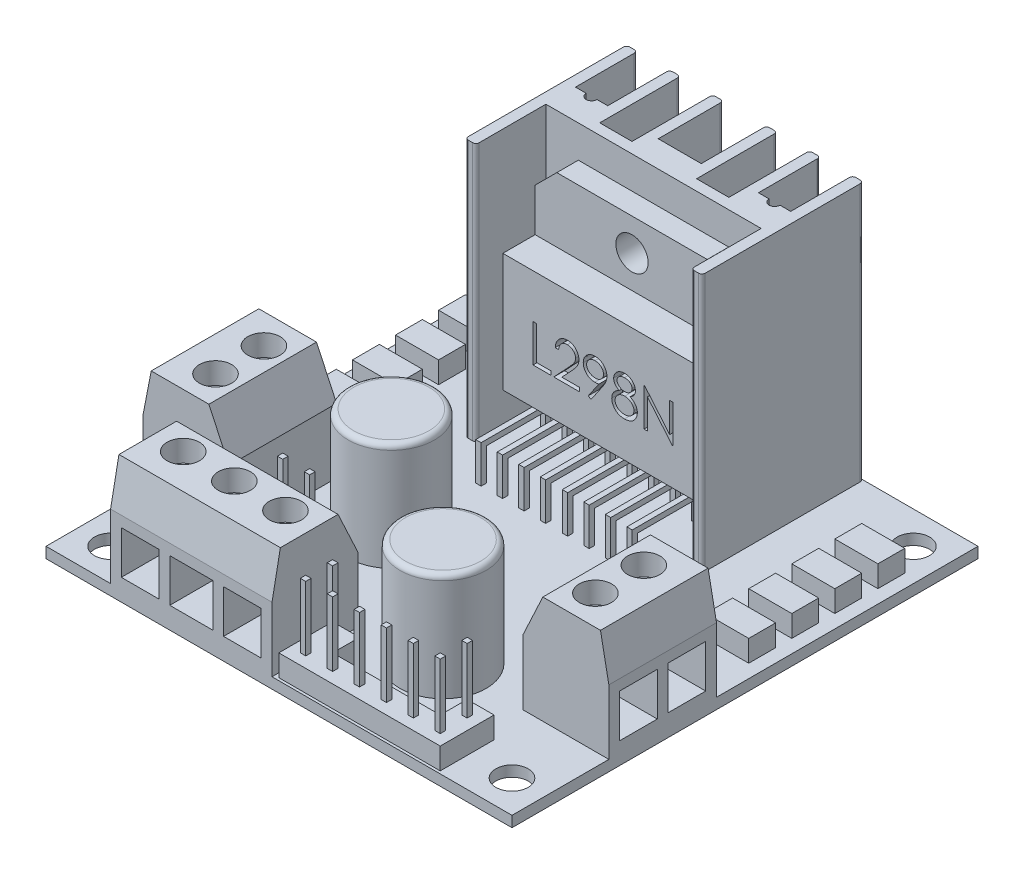
from build123d import *

# Parameters (mm, degrees)
CROQUIS1_W               = 43.3
CROQUIS1_H               = 43.3
CROQUIS1_R               = 1.5
SALIENTE_EXTRUIR1_DEPTH  = 1
SALIENTE_EXTRUIR2_DEPTH  = 24
CROQUIS3_W               = 8
CROQUIS3_H               = 10
SALIENTE_EXTRUIR3_DEPTH  = 10
CHAFL_N1_SIZE            = 4
CHAFL_N1_SIZE2           = 1.865230633
CHAFL_N2_SIZE            = 4
CHAFL_N2_SIZE2           = 1.865230633
CHAFL_N3_SIZE            = 4
CHAFL_N3_SIZE2           = 0.777521237
CHAFL_N4_SIZE            = 4
CHAFL_N4_SIZE2           = 0.777521237
CROQUIS4_W               = 15
CROQUIS4_H               = 8
SALIENTE_EXTRUIR4_DEPTH  = 10
CHAFL_N5_SIZE            = 4
CHAFL_N5_SIZE2           = 0.777521237
CHAFL_N6_SIZE            = 4
CHAFL_N6_SIZE2           = 1.865230633
CROQUIS5_W               = 4
CROQUIS5_H               = 2.5
SALIENTE_EXTRUIR5_DEPTH  = 2
CROQUIS6_R               = 4
SALIENTE_EXTRUIR6_DEPTH  = 10
REDONDEO1_R              = 0.5
SALIENTE_EXTRUIR7_DEPTH  = 2
CROQUIS8_W               = 5
CROQUIS8_H               = 2.5
SALIENTE_EXTRUIR8_DEPTH  = 2
CROQUIS9_W               = 0.5
CROQUIS9_H               = 0.5
SALIENTE_EXTRUIR9_DEPTH  = 6
CROQUIS10_W              = 0.5
CROQUIS10_H              = 0.5
SALIENTE_EXTRUIR10_DEPTH = 6
SALIENTE_EXTRUIR11_DEPTH = 5
CORTAR_EXTRUIR1_DEPTH    = 3
CROQUIS13_W              = 0.5
CROQUIS13_H              = 0.5
SALIENTE_EXTRUIR12_DEPTH = 1
CROQUIS14_W              = 0.5
CROQUIS14_H              = 0.5
SALIENTE_EXTRUIR13_DEPTH = 7
CROQUIS15_W              = 0.5
CROQUIS15_H              = 0.5
SALIENTE_EXTRUIR14_DEPTH = 4
CROQUIS16_W              = 0.5
CROQUIS16_H              = 0.5
SALIENTE_EXTRUIR15_DEPTH = 4
CORTAR_EXTRUIR2_DEPTH    = 1
CROQUIS18_R              = 1.5
CORTAR_EXTRUIR3_DEPTH    = 60.797407971
CROQUIS19_W              = 3.5
CROQUIS19_H              = 4
CORTAR_EXTRUIR4_DEPTH    = 4
CROQUIS20_W              = 3.5
CROQUIS20_H              = 4
CROQUIS20_W_2            = 4
CORTAR_EXTRUIR5_DEPTH    = 4
CROQUIS21_W              = 3.5
CROQUIS21_H              = 4
CORTAR_EXTRUIR6_DEPTH    = 4
CROQUIS22_R              = 1.5
CORTAR_EXTRUIR7_DEPTH    = 2
REDONDEO2_R              = 0.3


with BuildPart() as part:
    # Croquis1 → Saliente-Extruir1 (new body)
    with BuildSketch(Plane(origin=(0, 0, 0), x_dir=(1, 0, 0), z_dir=(0, 1, 0))):
        with Locations((-21.65, -21.65)):
            Rectangle(CROQUIS1_W, CROQUIS1_H)
        with Locations((-40.3, -40.3)):
            Circle(CROQUIS1_R, mode=Mode.SUBTRACT)
        with Locations((-3, -40.3)):
            Circle(CROQUIS1_R, mode=Mode.SUBTRACT)
        with Locations((-3, -3)):
            Circle(CROQUIS1_R, mode=Mode.SUBTRACT)
        with Locations((-40.3, -3)):
            Circle(CROQUIS1_R, mode=Mode.SUBTRACT)
    extrude(amount=SALIENTE_EXTRUIR1_DEPTH)

    # Croquis2 → Saliente-Extruir2 (add)
    with BuildSketch(Plane(origin=(0, 1, 0), x_dir=(-1, 0, 0), z_dir=(0, 1, 0))):
        with BuildLine():
            Line((10.65, 0), (11.65, 0))
            Line((11.65, 0), (11.65, 5.75316787))
            Line((11.65, 5.75316787), (12.645779613, 5.75316787))
            ThreePointArc((12.645779613, 5.75316787), (13.15, 6.257388257), (13.654220387, 5.75316787))
            Line((13.654220387, 5.75316787), (14.65, 5.75316787))
            Line((14.65, 5.75316787), (14.65, 0))
            Line((14.65, 0), (15.65, 0))
            Line((15.65, 0), (15.65, 7.5))
            Line((15.65, 7.5), (18.65, 7.5))
            Line((18.65, 7.5), (18.65, 0))
            Line((18.65, 0), (19.65, 0))
            Line((19.65, 0), (19.65, 6.064692241))
            Line((19.65, 6.064692241), (23.65, 6.064692241))
            Line((23.65, 6.064692241), (23.65, 0))
            Line((23.65, 0), (24.65, 0))
            Line((24.65, 0), (24.65, 7.5))
            Line((24.65, 7.5), (27.65, 7.5))
            Line((27.65, 7.5), (27.65, 0))
            Line((27.65, 0), (28.65, 0))
            Line((28.65, 0), (28.65, 5.75316787))
            Line((28.65, 5.75316787), (29.645779613, 5.75316787))
            ThreePointArc((29.645779613, 5.75316787), (30.15, 6.257388257), (30.654220387, 5.75316787))
            Line((30.654220387, 5.75316787), (31.65, 5.75316787))
            Line((31.65, 5.75316787), (31.65, 0))
            Line((31.65, 0), (32.65, 0))
            Line((32.65, 0), (32.65, 15))
            Line((32.65, 15), (31.65, 15))
            Line((31.65, 15), (31.65, 8.5))
            Line((31.65, 8.5), (11.65, 8.5))
            Line((11.65, 8.5), (11.65, 15))
            Line((11.65, 15), (10.65, 15))
            Line((10.65, 15), (10.65, 0))
        make_face()
    extrude(amount=SALIENTE_EXTRUIR2_DEPTH)

    # Croquis3 → Saliente-Extruir3 (add)
    with BuildSketch(Plane(origin=(0, 1, 0), x_dir=(-1, 0, 0), z_dir=(0, 1, 0))):
        with Locations((39.3, 29.3)):
            Rectangle(CROQUIS3_W, CROQUIS3_H)
        with Locations((4, 29.3)):
            Rectangle(CROQUIS3_W, CROQUIS3_H)
    extrude(amount=SALIENTE_EXTRUIR3_DEPTH)

    # Chaflán1
    chafl_n1_edges = [part.edges().sort_by_distance(p)[0] for p in [
        (-35.3, 11, 29.3),
    ]]
    chafl_n1_side = [part.faces().sort_by_distance(p)[0] for p in [
        (-35.3, 6, 29.3),
    ]]
    chamfer(chafl_n1_edges, length=CHAFL_N1_SIZE, length2=CHAFL_N1_SIZE2, reference=chafl_n1_side[0])

    # Chaflán2
    chafl_n2_edges = [part.edges().sort_by_distance(p)[0] for p in [
        (-8, 11, 29.3),
    ]]
    chafl_n2_side = [part.faces().sort_by_distance(p)[0] for p in [
        (-8, 6, 29.3),
    ]]
    chamfer(chafl_n2_edges, length=CHAFL_N2_SIZE, length2=CHAFL_N2_SIZE2, reference=chafl_n2_side[0])

    # Chaflán3
    chafl_n3_edges = [part.edges().sort_by_distance(p)[0] for p in [
        (0, 11, 29.3),
    ]]
    chafl_n3_side = [part.faces().sort_by_distance(p)[0] for p in [
        (0, 4.338101884, 26.988450803),
    ]]
    chamfer(chafl_n3_edges, length=CHAFL_N3_SIZE, length2=CHAFL_N3_SIZE2, reference=chafl_n3_side[0])

    # Chaflán4
    chafl_n4_edges = [part.edges().sort_by_distance(p)[0] for p in [
        (-43.3, 11, 29.3),
    ]]
    chafl_n4_side = [part.faces().sort_by_distance(p)[0] for p in [
        (-43.3, 4.338101884, 26.988450803),
    ]]
    chamfer(chafl_n4_edges, length=CHAFL_N4_SIZE, length2=CHAFL_N4_SIZE2, reference=chafl_n4_side[0])

    # Croquis4 → Saliente-Extruir4 (add)
    with BuildSketch(Plane(origin=(0, 1, 0), x_dir=(-1, 0, 0), z_dir=(0, 1, 0))):
        with Locations((29.8, 39.3)):
            Rectangle(CROQUIS4_W, CROQUIS4_H)
    extrude(amount=SALIENTE_EXTRUIR4_DEPTH)

    # Chaflán5
    chafl_n5_edges = [part.edges().sort_by_distance(p)[0] for p in [
        (-29.8, 11, 43.3),
    ]]
    chafl_n5_side = [part.faces().sort_by_distance(p)[0] for p in [
        (-27.97436627, 4.767977237, 43.3),
    ]]
    chamfer(chafl_n5_edges, length=CHAFL_N5_SIZE, length2=CHAFL_N5_SIZE2, reference=chafl_n5_side[0])

    # Chaflán6
    chafl_n6_edges = [part.edges().sort_by_distance(p)[0] for p in [
        (-29.8, 11, 35.3),
    ]]
    chafl_n6_side = [part.faces().sort_by_distance(p)[0] for p in [
        (-29.8, 6, 35.3),
    ]]
    chamfer(chafl_n6_edges, length=CHAFL_N6_SIZE, length2=CHAFL_N6_SIZE2, reference=chafl_n6_side[0])

    # Croquis5 → Saliente-Extruir5 (add)
    with BuildSketch(Plane(origin=(0, 1, 0), x_dir=(-1, 0, 0), z_dir=(0, 1, 0))):
        with Locations((3.239216948, 10.814133786)):
            Rectangle(CROQUIS5_W, CROQUIS5_H)
        with Locations((3.239216948, 6.814133786)):
            Rectangle(CROQUIS5_W, CROQUIS5_H)
        with Locations((3.239216948, 14.814133786)):
            Rectangle(CROQUIS5_W, CROQUIS5_H)
        with Locations((3.239216948, 18.814133786)):
            Rectangle(CROQUIS5_W, CROQUIS5_H)
        with Locations((40.060783052, 18.814133786)):
            Rectangle(CROQUIS5_W, CROQUIS5_H)
        with Locations((40.060783052, 14.814133786)):
            Rectangle(CROQUIS5_W, CROQUIS5_H)
        with Locations((40.060783052, 10.814133786)):
            Rectangle(CROQUIS5_W, CROQUIS5_H)
        with Locations((40.060783052, 6.814133786)):
            Rectangle(CROQUIS5_W, CROQUIS5_H)
    extrude(amount=SALIENTE_EXTRUIR5_DEPTH)

    # Croquis6 → Saliente-Extruir6 (add)
    with BuildSketch(Plane(origin=(0, 1, 0), x_dir=(-1, 0, 0), z_dir=(0, 1, 0))):
        with Locations((28.3, 26.210008209)):
            Circle(CROQUIS6_R)
        with Locations((15.406645961, 34.3)):
            Circle(CROQUIS6_R)
    extrude(amount=SALIENTE_EXTRUIR6_DEPTH)

    # Redondeo1
    redondeo1_edges = [part.edges().sort_by_distance(p)[0] for p in [
        (-24.3, 11, 26.210008209),
        (-11.406645961, 11, 34.3),
    ]]
    fillet(redondeo1_edges, radius=REDONDEO1_R)

    # Croquis7 → Saliente-Extruir7 (add)
    with BuildSketch(Plane(origin=(0, 1, 0), x_dir=(-1, 0, 0), z_dir=(0, 1, 0))):
        Polygon((19.407725127, 40.559550143), (19.407725127, 38.059550143), (21.907725127, 38.059550143), (21.907725127, 40.559550143), (21.907725127, 43.059550143), (6.907725127, 43.059550143), (6.907725127, 38.059550143), (9.407725127, 38.059550143), (9.407725127, 40.559550143), align=None)
    extrude(amount=SALIENTE_EXTRUIR7_DEPTH)

    # Croquis8 → Saliente-Extruir8 (add)
    with BuildSketch(Plane(origin=(0, 1, 0), x_dir=(-1, 0, 0), z_dir=(0, 1, 0))):
        with Locations((30.3, 33.05)):
            Rectangle(CROQUIS8_W, CROQUIS8_H)
    extrude(amount=SALIENTE_EXTRUIR8_DEPTH)

    # Croquis9 → Saliente-Extruir9 (add)
    with BuildSketch(Plane(origin=(0, 3, 0), x_dir=(-1, 0, 0), z_dir=(0, 1, 0))):
        with Locations((20.657725127, 39.309550143)):
            Rectangle(CROQUIS9_W, CROQUIS9_H)
        with Locations((8.157725127, 39.309550143)):
            Rectangle(CROQUIS9_W, CROQUIS9_H)
        with Locations((20.657725127, 41.809550143)):
            Rectangle(CROQUIS9_W, CROQUIS9_H)
        with Locations((8.157725127, 41.809550143)):
            Rectangle(CROQUIS9_W, CROQUIS9_H)
        with Locations((18.157725127, 41.809550143)):
            Rectangle(CROQUIS9_W, CROQUIS9_H)
        with Locations((10.657725127, 41.809550143)):
            Rectangle(CROQUIS9_W, CROQUIS9_H)
        with Locations((15.657725127, 41.809550143)):
            Rectangle(CROQUIS9_W, CROQUIS9_H)
        with Locations((13.157725127, 41.809550143)):
            Rectangle(CROQUIS9_W, CROQUIS9_H)
    extrude(amount=SALIENTE_EXTRUIR9_DEPTH)

    # Croquis10 → Saliente-Extruir10 (add)
    with BuildSketch(Plane(origin=(0, 3, 0), x_dir=(1, 0, 0), z_dir=(0, 1, 0))):
        with Locations((-29.05, -33.05)):
            Rectangle(CROQUIS10_W, CROQUIS10_H)
        with Locations((-31.55, -33.05)):
            Rectangle(CROQUIS10_W, CROQUIS10_H)
    extrude(amount=SALIENTE_EXTRUIR10_DEPTH)

    # Croquis11 → Saliente-Extruir11 (add)
    with BuildSketch(Plane.XY.offset(8.5)):
        Polygon((-14.662533558, 22), (-28.637466442, 22), (-30.65, 19.987466442), (-30.65, 5), (-12.65, 5), (-12.65, 19.987466442), align=None)
    extrude(amount=SALIENTE_EXTRUIR11_DEPTH)

    # Croquis12 → Cortar-Extruir1 (cut)
    with BuildSketch(Plane.XY.offset(13.5)):
        Polygon((-14.662533558, 22), (-28.637466442, 22), (-30.65, 19.987466442), (-30.65, 16), (-12.65, 16), (-12.65, 19.987466442), align=None)
    extrude(amount=-CORTAR_EXTRUIR1_DEPTH, mode=Mode.SUBTRACT)

    # Croquis13 → Saliente-Extruir12 (add)
    with BuildSketch(Plane.XZ.offset(-5)):
        with Locations((-28.173070454, 11)):
            Rectangle(CROQUIS13_W, CROQUIS13_H)
        with Locations((-29.173070454, 11)):
            Rectangle(CROQUIS13_W, CROQUIS13_H)
        with Locations((-27.173070454, 11)):
            Rectangle(CROQUIS13_W, CROQUIS13_H)
        with Locations((-26.173070454, 11)):
            Rectangle(CROQUIS13_W, CROQUIS13_H)
        with Locations((-25.173070454, 11)):
            Rectangle(CROQUIS13_W, CROQUIS13_H)
        with Locations((-24.173070454, 11)):
            Rectangle(CROQUIS13_W, CROQUIS13_H)
        with Locations((-23.173070454, 11)):
            Rectangle(CROQUIS13_W, CROQUIS13_H)
        with Locations((-22.173070454, 11)):
            Rectangle(CROQUIS13_W, CROQUIS13_H)
        with Locations((-21.126929546, 11)):
            Rectangle(CROQUIS13_W, CROQUIS13_H)
        with Locations((-20.126929546, 11)):
            Rectangle(CROQUIS13_W, CROQUIS13_H)
        with Locations((-19.126929546, 11)):
            Rectangle(CROQUIS13_W, CROQUIS13_H)
        with Locations((-18.126929546, 11)):
            Rectangle(CROQUIS13_W, CROQUIS13_H)
        with Locations((-17.126929546, 11)):
            Rectangle(CROQUIS13_W, CROQUIS13_H)
        with Locations((-16.126929546, 11)):
            Rectangle(CROQUIS13_W, CROQUIS13_H)
        with Locations((-15.126929546, 11)):
            Rectangle(CROQUIS13_W, CROQUIS13_H)
        with Locations((-14.126929546, 11)):
            Rectangle(CROQUIS13_W, CROQUIS13_H)
    extrude(amount=SALIENTE_EXTRUIR12_DEPTH)

    # Croquis14 → Saliente-Extruir13 (add)
    with BuildSketch(Plane.XY.offset(11.25)):
        with Locations((-14.126929546, 4.25)):
            Rectangle(CROQUIS14_W, CROQUIS14_H)
        with Locations((-16.126929546, 4.25)):
            Rectangle(CROQUIS14_W, CROQUIS14_H)
        with Locations((-18.126929546, 4.25)):
            Rectangle(CROQUIS14_W, CROQUIS14_H)
        with Locations((-20.126929546, 4.25)):
            Rectangle(CROQUIS14_W, CROQUIS14_H)
        with Locations((-22.173070454, 4.25)):
            Rectangle(CROQUIS14_W, CROQUIS14_H)
        with Locations((-24.173070454, 4.25)):
            Rectangle(CROQUIS14_W, CROQUIS14_H)
        with Locations((-26.173070454, 4.25)):
            Rectangle(CROQUIS14_W, CROQUIS14_H)
        with Locations((-28.173070454, 4.25)):
            Rectangle(CROQUIS14_W, CROQUIS14_H)
    extrude(amount=SALIENTE_EXTRUIR13_DEPTH)

    # Croquis15 → Saliente-Extruir14 (add)
    with BuildSketch(Plane.XZ):
        with Locations((-28.173070454, 18)):
            Rectangle(CROQUIS15_W, CROQUIS15_H)
        with Locations((-26.173070454, 18)):
            Rectangle(CROQUIS15_W, CROQUIS15_H)
        with Locations((-24.173070454, 18)):
            Rectangle(CROQUIS15_W, CROQUIS15_H)
        with Locations((-22.173070454, 18)):
            Rectangle(CROQUIS15_W, CROQUIS15_H)
        with Locations((-20.126929546, 18)):
            Rectangle(CROQUIS15_W, CROQUIS15_H)
        with Locations((-18.126929546, 18)):
            Rectangle(CROQUIS15_W, CROQUIS15_H)
        with Locations((-16.126929546, 18)):
            Rectangle(CROQUIS15_W, CROQUIS15_H)
        with Locations((-14.126929546, 18)):
            Rectangle(CROQUIS15_W, CROQUIS15_H)
    extrude(amount=-SALIENTE_EXTRUIR14_DEPTH)

    # Croquis16 → Saliente-Extruir15 (add)
    with BuildSketch(Plane.XZ):
        with Locations((-29.173070454, 11)):
            Rectangle(CROQUIS16_W, CROQUIS16_H)
        with Locations((-27.173070454, 11)):
            Rectangle(CROQUIS16_W, CROQUIS16_H)
        with Locations((-25.173070454, 11)):
            Rectangle(CROQUIS16_W, CROQUIS16_H)
        with Locations((-23.173070454, 11)):
            Rectangle(CROQUIS16_W, CROQUIS16_H)
        with Locations((-21.126929546, 11)):
            Rectangle(CROQUIS16_W, CROQUIS16_H)
        with Locations((-19.126929546, 11)):
            Rectangle(CROQUIS16_W, CROQUIS16_H)
        with Locations((-17.126929546, 11)):
            Rectangle(CROQUIS16_W, CROQUIS16_H)
        with Locations((-15.126929546, 11)):
            Rectangle(CROQUIS16_W, CROQUIS16_H)
    extrude(amount=-SALIENTE_EXTRUIR15_DEPTH)

    # Croquis17 → Cortar-Extruir2 (cut)
    # profile 1 of 5: a face of its own
    with BuildSketch(Plane.XY.offset(13.5)):
        Polygon((-27.846931762, 11.915865738), (-27.532829198, 11.915865738), (-27.532829198, 8.774840097), (-26.186675351, 8.774840097), (-26.186675351, 8.415865738), (-27.846931762, 8.415865738), align=None)
    # profile 2 of 5: a face of its own
    with BuildSketch(Plane.XY.offset(13.5)):
        with BuildLine():
            Line((-25.468726633, 10.838942661), (-25.782829198, 10.838942661))
            add(Edge.make_bspline(
                [(-25.782829198, 10.838942661), (-25.780782045, 10.880613549), (-25.77676149, 10.962454063), (-25.757933201, 11.08177797), (-25.730992324, 11.195832768), (-25.69290087, 11.303702682), (-25.645594592, 11.40634149), (-25.588864565, 11.503341505), (-25.521670714, 11.594332694), (-25.44546398, 11.678471537), (-25.362695341, 11.755659108), (-25.273389402, 11.822314351), (-25.179544374, 11.878632022), (-25.081444976, 11.925713264), (-24.977984412, 11.96105311), (-24.870101554, 11.98727475), (-24.757322418, 12.003051095), (-24.680482396, 12.004746881), (-24.641402915, 12.005609328)],
                knots=[0, 0, 0, 0, 1.10065271, 2.161652631, 3.183658789, 4.190468796, 5.17591951, 6.163126047, 7.15150782, 8.156236427, 9.156009102, 10.134482811, 11.092018607, 12.041330605, 13.001268258, 13.972401359, 14.968799086, 16, 16, 16, 16], degree=3))
            add(Edge.make_bspline(
                [(-24.641402915, 12.005609328), (-24.603024841, 12.004710871), (-24.527613297, 12.002945436), (-24.417551282, 11.987784407), (-24.312773988, 11.964038815), (-24.213486221, 11.930723399), (-24.120480157, 11.885938972), (-24.033057112, 11.832141433), (-23.950176301, 11.769921602), (-23.875569518, 11.696667788), (-23.807061439, 11.618465404), (-23.747959183, 11.5349775), (-23.69734602, 11.448748214), (-23.65515834, 11.359120013), (-23.624102201, 11.265248985), (-23.600523993, 11.168501782), (-23.587196579, 11.067876971), (-23.585151156, 10.999770415), (-23.584111249, 10.965144584)],
                knots=[0, 0, 0, 0, 1.111607364, 2.184268762, 3.212621178, 4.221274766, 5.211760367, 6.196651075, 7.1921475, 8.207485113, 9.220403448, 10.201281604, 11.166441695, 12.114753415, 13.065576456, 14.026450734, 14.996634279, 16, 16, 16, 16], degree=3))
            add(Edge.make_bspline(
                [(-23.584111249, 10.965144584), (-23.585804512, 10.916396749), (-23.589161323, 10.819756536), (-23.6178757, 10.677741673), (-23.662722211, 10.540148254), (-23.716719568, 10.429410952), (-23.771192012, 10.340177458), (-23.820279519, 10.266708753), (-23.87774433, 10.187603285), (-23.944422828, 10.103125947), (-24.0189357, 10.012615042), (-24.101957864, 9.916125247), (-24.194081346, 9.814653477), (-24.258739846, 9.745347876), (-24.292244262, 9.709435449)],
                knots=[0, 0, 0, 0, 1.184426356, 2.348067706, 3.509069118, 4.696110526, 5.333549288, 6.050745305, 6.844228056, 7.710549037, 8.667450064, 9.695053472, 10.805634456, 12, 12, 12, 12], degree=3))
            Line((-24.292244262, 9.709435449), (-25.167945383, 8.774840097))
            Line((-25.167945383, 8.774840097), (-23.539239454, 8.774840097))
            Line((-23.539239454, 8.774840097), (-23.539239454, 8.415865738))
            Line((-23.539239454, 8.415865738), (-25.917444582, 8.415865738))
            Line((-25.917444582, 8.415865738), (-24.560072787, 9.864383366))
            add(Edge.make_bspline(
                [(-24.560072787, 9.864383366), (-24.5270249, 9.898881673), (-24.463546673, 9.965145859), (-24.373764097, 10.061888819), (-24.293125108, 10.15163836), (-24.221107715, 10.234224909), (-24.15927421, 10.310856476), (-24.104401978, 10.37905118), (-24.060436387, 10.44180563), (-24.012720991, 10.514546244), (-23.96650701, 10.603358561), (-23.926794654, 10.711892251), (-23.902579806, 10.823619503), (-23.89967497, 10.89912154), (-23.898213813, 10.937099712)],
                knots=[0, 0, 0, 0, 1.329631726, 2.553950428, 3.673215718, 4.687767853, 5.603093632, 6.413772471, 7.123043292, 7.734684054, 8.834405432, 9.900288307, 10.943827018, 12, 12, 12, 12], degree=3))
            add(Edge.make_bspline(
                [(-23.898213813, 10.937099712), (-23.898849555, 10.960981111), (-23.900102481, 11.008046761), (-23.911160179, 11.07705252), (-23.927870685, 11.143617334), (-23.951815943, 11.207945953), (-23.983422683, 11.269391605), (-24.021896063, 11.328029085), (-24.066286126, 11.38471805), (-24.117637396, 11.437871349), (-24.174048915, 11.486552554), (-24.233643165, 11.529676639), (-24.296693269, 11.56571575), (-24.362933391, 11.595259247), (-24.432178861, 11.618434629), (-24.504563606, 11.634493208), (-24.579887622, 11.644575692), (-24.631321118, 11.645939864), (-24.657528717, 11.646634969)],
                knots=[0, 0, 0, 0, 0.991446411, 1.95395049, 2.89581595, 3.838931463, 4.798493298, 5.75982156, 6.748411868, 7.785213223, 8.824556874, 9.840280684, 10.836137867, 11.835679398, 12.848801643, 13.863922112, 14.911575587, 16, 16, 16, 16], degree=3))
            add(Edge.make_bspline(
                [(-24.657528717, 11.646634969), (-24.68489955, 11.645919936), (-24.738651346, 11.644515731), (-24.817570379, 11.634693067), (-24.892856156, 11.617747227), (-24.964698059, 11.594570552), (-25.033217645, 11.565112004), (-25.098081689, 11.528420259), (-25.159144578, 11.484636766), (-25.216521102, 11.434996209), (-25.269385081, 11.379728608), (-25.315831957, 11.318118645), (-25.356415971, 11.25129123), (-25.391825204, 11.179426679), (-25.420580894, 11.101872899), (-25.442554045, 11.018905194), (-25.459940891, 10.930883813), (-25.465749412, 10.870098728), (-25.468726633, 10.838942661)],
                knots=[0, 0, 0, 0, 1.031018746, 2.02475058, 2.990194455, 3.934040569, 4.864654155, 5.795059489, 6.735614925, 7.690564532, 8.649604399, 9.611025574, 10.590972636, 11.591080095, 12.624614302, 13.701020113, 14.821632451, 16, 16, 16, 16], degree=3))
        make_face()
    # profile 3 of 5: a face of its own
    with BuildSketch(Plane.XY.offset(13.5)):
        with BuildLine():
            Line((-22.462316377, 8.326122148), (-22.71331798, 8.500701475))
            Line((-22.71331798, 8.500701475), (-21.740160928, 9.923277597))
            add(Edge.make_bspline(
                [(-21.740160928, 9.923277597), (-21.802251664, 9.915684534), (-21.924511784, 9.900733369), (-22.047648886, 9.897986714), (-22.108249871, 9.896634969)],
                knots=[0, 0, 0, 0, 1.015715272, 2, 2, 2, 2], degree=3))
            add(Edge.make_bspline(
                [(-22.108249871, 9.896634969), (-22.144991918, 9.897576045), (-22.217113345, 9.899423296), (-22.323144998, 9.914065104), (-22.425030558, 9.936615232), (-22.522499914, 9.970263987), (-22.615919419, 10.012082196), (-22.705085133, 10.06393921), (-22.789877023, 10.124945501), (-22.869384433, 10.194778493), (-22.941696172, 10.271456545), (-23.00611947, 10.352612188), (-23.059660602, 10.439188159), (-23.104137187, 10.529418378), (-23.137867641, 10.624599729), (-23.162430178, 10.723649129), (-23.177552532, 10.827260771), (-23.179351628, 10.897785902), (-23.180265095, 10.933594103)],
                knots=[0, 0, 0, 0, 1.060718605, 2.082097864, 3.085795603, 4.069760067, 5.054557537, 6.03741023, 7.043284206, 8.066802108, 9.088538119, 10.083643548, 11.053783639, 12.022749082, 12.983451788, 13.964007469, 14.966251758, 16, 16, 16, 16], degree=3))
            add(Edge.make_bspline(
                [(-23.180265095, 10.933594103), (-23.17853066, 10.982562756), (-23.175126317, 11.078678288), (-23.147727799, 11.219112057), (-23.10266746, 11.3518986), (-23.039839083, 11.476688794), (-22.960704362, 11.591687533), (-22.865595772, 11.695296142), (-22.755091807, 11.786040996), (-22.631709788, 11.864045074), (-22.498356768, 11.926780071), (-22.358688109, 11.973019371), (-22.213773989, 12.000218119), (-22.115606319, 12.00380398), (-22.066182563, 12.005609328)],
                knots=[0, 0, 0, 0, 1.022988612, 2.007919123, 2.978103895, 3.94594894, 4.918897164, 5.887013414, 6.875921846, 7.89917871, 8.930658928, 9.948724884, 10.967259574, 12, 12, 12, 12], degree=3))
            add(Edge.make_bspline(
                [(-22.066182563, 12.005609328), (-22.017694143, 12.003779165), (-21.921885596, 12.000162935), (-21.78099659, 11.973678966), (-21.646055573, 11.929042293), (-21.517810586, 11.867357729), (-21.399071174, 11.790036822), (-21.292295363, 11.697902298), (-21.199919824, 11.590896771), (-21.122095943, 11.471608281), (-21.059625903, 11.343441299), (-21.01455362, 11.209657377), (-20.986807981, 11.071218656), (-20.983311654, 10.977424181), (-20.981547146, 10.930088494)],
                knots=[0, 0, 0, 0, 1.026385292, 2.028040595, 3.023318987, 4.028184125, 5.03290303, 6.015178782, 7.004435299, 8.016004309, 9.023023918, 10.015172535, 10.998308025, 12, 12, 12, 12], degree=3))
            add(Edge.make_bspline(
                [(-20.981547146, 10.930088494), (-20.982725555, 10.893344727), (-20.985115663, 10.818819186), (-21.00185197, 10.705588844), (-21.030272155, 10.590137614), (-21.062523854, 10.492416018), (-21.093656022, 10.411707569), (-21.122957153, 10.347955989), (-21.155469307, 10.280854725), (-21.193388072, 10.211107387), (-21.234150369, 10.137824852), (-21.280209646, 10.061742137), (-21.330515217, 9.982757144), (-21.366344937, 9.929510056), (-21.384692178, 9.902243943)],
                knots=[0, 0, 0, 0, 1.179839688, 2.393009684, 3.667231171, 4.993948276, 5.694988576, 6.444077775, 7.246288328, 8.089075292, 8.993003841, 9.939041771, 10.944649915, 12, 12, 12, 12], degree=3))
            Line((-21.384692178, 9.902243943), (-22.462316377, 8.326122148))
        make_face()
        with BuildLine():
            add(Edge.make_bspline(
                [(-22.050056762, 10.255609328), (-22.022222748, 10.256369711), (-21.968039384, 10.25784992), (-21.888662085, 10.266859162), (-21.813737882, 10.282833148), (-21.743066633, 10.30575286), (-21.675939731, 10.333409529), (-21.613423403, 10.368621515), (-21.555465327, 10.41063815), (-21.5016774, 10.457848166), (-21.453913401, 10.510298749), (-21.41137037, 10.565195856), (-21.375209802, 10.622780466), (-21.346646525, 10.683773728), (-21.32316195, 10.746690937), (-21.306943938, 10.812545292), (-21.297959605, 10.880993693), (-21.29642803, 10.927492351), (-21.29564971, 10.951122148)],
                knots=[0, 0, 0, 0, 1.163407946, 2.26475976, 3.333800367, 4.359385343, 5.366239384, 6.363380779, 7.350133999, 8.353570782, 9.349036268, 10.310270964, 11.253520213, 12.184142, 13.120487599, 14.056272588, 15.012232024, 16, 16, 16, 16], degree=3))
            add(Edge.make_bspline(
                [(-21.29564971, 10.951122148), (-21.29631938, 10.974761813), (-21.297639045, 11.021346673), (-21.308226344, 11.089896413), (-21.326851568, 11.155589674), (-21.351842052, 11.218786104), (-21.38476229, 11.278966476), (-21.424265776, 11.336886348), (-21.471198226, 11.392178475), (-21.525200792, 11.443542459), (-21.583435345, 11.490890358), (-21.645495845, 11.532676434), (-21.710870761, 11.567697631), (-21.779161251, 11.5965966), (-21.8505096, 11.619148376), (-21.924873588, 11.635365741), (-22.002628994, 11.644337495), (-22.05541028, 11.64585939), (-22.082308364, 11.646634969)],
                knots=[0, 0, 0, 0, 0.972161553, 1.915763587, 2.844109794, 3.775983486, 4.705125789, 5.659731448, 6.655561913, 7.682237399, 8.721216875, 9.739758359, 10.754845918, 11.767244016, 12.7857855, 13.828538656, 14.893392813, 16, 16, 16, 16], degree=3))
            add(Edge.make_bspline(
                [(-22.082308364, 11.646634969), (-22.108972518, 11.645858137), (-22.161287367, 11.644334), (-22.238351526, 11.635382794), (-22.312212694, 11.61903931), (-22.383354314, 11.596607046), (-22.451642775, 11.567695475), (-22.517014608, 11.532674599), (-22.579089624, 11.490899977), (-22.637268345, 11.443505204), (-22.691366267, 11.392417558), (-22.737491796, 11.336644129), (-22.777085688, 11.278996605), (-22.809960691, 11.218778097), (-22.834963208, 11.155591811), (-22.85358521, 11.089895834), (-22.864173375, 11.021346824), (-22.865492922, 10.974761864), (-22.866162531, 10.951122148)],
                knots=[0, 0, 0, 0, 1.099389452, 2.15699305, 3.192601482, 4.213358962, 5.227959689, 6.245255729, 7.266013209, 8.307253147, 9.336162325, 10.327954924, 11.284637477, 12.215801273, 13.149702402, 14.080068371, 15.025723358, 16, 16, 16, 16], degree=3))
            add(Edge.make_bspline(
                [(-22.866162531, 10.951122148), (-22.865556605, 10.927473949), (-22.864361608, 10.880835373), (-22.852833818, 10.81230898), (-22.833555538, 10.746620786), (-22.807736147, 10.683132079), (-22.773734557, 10.622460221), (-22.732010709, 10.564892859), (-22.683105163, 10.509777409), (-22.627671676, 10.457970197), (-22.567003515, 10.410418022), (-22.502206769, 10.36888764), (-22.434396932, 10.333815195), (-22.363335301, 10.305673811), (-22.289548501, 10.283062148), (-22.21237337, 10.266888603), (-22.132065132, 10.257936336), (-22.07765515, 10.256392439), (-22.050056762, 10.255609328)],
                knots=[0, 0, 0, 0, 0.952633368, 1.87876736, 2.791047057, 3.707742249, 4.635551637, 5.587206343, 6.568248508, 7.601284464, 8.641511608, 9.671105535, 10.699146789, 11.713763218, 12.747829548, 13.806491675, 14.887386225, 16, 16, 16, 16], degree=3))
        make_face(mode=Mode.SUBTRACT)
    # profile 4 of 5: a face of its own
    with BuildSketch(Plane.XY.offset(13.5)):
        with BuildLine():
            add(Edge.make_bspline(
                [(-18.831206601, 10.365685449), (-18.802558054, 10.350747493), (-18.74668382, 10.321613491), (-18.667106611, 10.274702663), (-18.59438161, 10.225261698), (-18.526491048, 10.175625839), (-18.464627698, 10.123894187), (-18.409483285, 10.069861031), (-18.359695665, 10.014875086), (-18.316268881, 9.958005246), (-18.278072044, 9.899402596), (-18.245059909, 9.838913323), (-18.216842706, 9.77666999), (-18.194479767, 9.71199316), (-18.176057976, 9.645832898), (-18.163382371, 9.577334916), (-18.156565453, 9.506950575), (-18.155276639, 9.459382274), (-18.154624069, 9.435296828)],
                knots=[0, 0, 0, 0, 1.272397273, 2.481599622, 3.635517121, 4.734568067, 5.792894095, 6.808321871, 7.773003508, 8.711915296, 9.623354172, 10.525449501, 11.423591555, 12.311487226, 13.218079475, 14.126165749, 15.051214107, 16, 16, 16, 16], degree=3))
            add(Edge.make_bspline(
                [(-18.154624069, 9.435296828), (-18.15539549, 9.401599095), (-18.156922421, 9.334898638), (-18.170222405, 9.236452527), (-18.190135383, 9.140840745), (-18.219214895, 9.048084254), (-18.256928286, 8.958694881), (-18.303405122, 8.872596107), (-18.356016327, 8.788376798), (-18.398268567, 8.736557396), (-18.419648108, 8.710336892)],
                knots=[0, 0, 0, 0, 1.025265484, 2.029385089, 3.018602448, 3.995076438, 4.983346944, 5.966715145, 6.97116228, 8, 8, 8, 8], degree=3))
            add(Edge.make_bspline(
                [(-18.419648108, 8.710336892), (-18.447484582, 8.679743118), (-18.502813548, 8.618933625), (-18.597596475, 8.539982815), (-18.701618359, 8.473633421), (-18.814476692, 8.419561526), (-18.935869793, 8.377475667), (-19.065771798, 8.347233149), (-19.204435951, 8.32991072), (-19.299741422, 8.327406731), (-19.348634486, 8.326122148)],
                knots=[0, 0, 0, 0, 0.954267603, 1.896743057, 2.838368354, 3.796610408, 4.779680527, 5.799409237, 6.871065594, 8, 8, 8, 8], degree=3))
            add(Edge.make_bspline(
                [(-19.348634486, 8.326122148), (-19.395647875, 8.327274626), (-19.487131154, 8.329517231), (-19.620289031, 8.344711663), (-19.744412101, 8.371339529), (-19.860222069, 8.407784139), (-19.967020763, 8.455194367), (-20.064503864, 8.514202776), (-20.154077836, 8.582434218), (-20.23302431, 8.661848296), (-20.303112753, 8.746906168), (-20.364680807, 8.834657778), (-20.415854885, 8.925111136), (-20.45918198, 9.016917503), (-20.492350003, 9.111363657), (-20.515322213, 9.20796367), (-20.529911527, 9.306548813), (-20.531852662, 9.373080466), (-20.532829198, 9.406550834)],
                knots=[0, 0, 0, 0, 1.256902934, 2.445805442, 3.576955095, 4.645999104, 5.686449165, 6.692658513, 7.68621702, 8.689161843, 9.678783111, 10.630372946, 11.551080876, 12.453998257, 13.34127905, 14.221779781, 15.105423033, 16, 16, 16, 16], degree=3))
            add(Edge.make_bspline(
                [(-20.532829198, 9.406550834), (-20.532251316, 9.431110026), (-20.53110922, 9.479647658), (-20.523204371, 9.551356986), (-20.51049591, 9.621153121), (-20.493236453, 9.689293865), (-20.469845427, 9.755283137), (-20.441603294, 9.819433611), (-20.408671341, 9.88181771), (-20.370590176, 9.942776591), (-20.326288152, 10.001456103), (-20.276124502, 10.058852098), (-20.219096634, 10.114073965), (-20.155838975, 10.16779639), (-20.087074435, 10.220972364), (-20.011016905, 10.270728092), (-19.929682637, 10.320586057), (-19.871877231, 10.350394382), (-19.84222423, 10.365685449)],
                knots=[0, 0, 0, 0, 0.941657376, 1.861047343, 2.762797495, 3.66048619, 4.553285746, 5.444104102, 6.34607688, 7.256116206, 8.197091036, 9.162375105, 10.176350973, 11.237807142, 12.343728897, 13.50695164, 14.721116704, 16, 16, 16, 16], degree=3))
            add(Edge.make_bspline(
                [(-19.84222423, 10.365685449), (-19.882815604, 10.387820218), (-19.961411867, 10.430679326), (-20.065481308, 10.509426132), (-20.154871932, 10.594713947), (-20.227126649, 10.688343741), (-20.283998877, 10.787390616), (-20.323017482, 10.891234868), (-20.349413966, 10.997950982), (-20.352028793, 11.070857178), (-20.353342018, 11.107472308)],
                knots=[0, 0, 0, 0, 1.166880483, 2.259407225, 3.286803203, 4.280235371, 5.237608625, 6.161067461, 7.076446754, 8, 8, 8, 8], degree=3))
            add(Edge.make_bspline(
                [(-20.353342018, 11.107472308), (-20.351706594, 11.144769867), (-20.348419106, 11.219744464), (-20.321835786, 11.331350587), (-20.278515719, 11.440967152), (-20.219594722, 11.548062865), (-20.146207506, 11.64901308), (-20.05816096, 11.739554026), (-19.957557663, 11.818865508), (-19.844899796, 11.885441681), (-19.723663561, 11.93962534), (-19.595747837, 11.977003763), (-19.463381344, 12.001439879), (-19.373283624, 12.004206534), (-19.327600832, 12.005609328)],
                knots=[0, 0, 0, 0, 0.888701115, 1.786444228, 2.72001202, 3.692817113, 4.693886446, 5.687152267, 6.695133018, 7.739871481, 8.800368666, 9.853104506, 10.91144658, 12, 12, 12, 12], degree=3))
            add(Edge.make_bspline(
                [(-19.327600832, 12.005609328), (-19.283097017, 12.004162985), (-19.195340564, 12.001310961), (-19.066345936, 11.977524083), (-18.942921059, 11.937794563), (-18.82549156, 11.88389734), (-18.716159693, 11.817510399), (-18.619557383, 11.737109525), (-18.534224801, 11.646967974), (-18.463640407, 11.546048371), (-18.405477518, 11.439364177), (-18.364976617, 11.327741656), (-18.339024643, 11.213592597), (-18.335751278, 11.136354593), (-18.334111249, 11.097656603)],
                knots=[0, 0, 0, 0, 1.072916533, 2.115669174, 3.151510826, 4.193348718, 5.225979165, 6.227137561, 7.216255879, 8.211077061, 9.189680878, 10.138522389, 11.067357538, 12, 12, 12, 12], degree=3))
            add(Edge.make_bspline(
                [(-18.334111249, 11.097656603), (-18.335545809, 11.059679939), (-18.338363205, 10.98509593), (-18.362063145, 10.87636941), (-18.401976458, 10.774547371), (-18.456470621, 10.678474419), (-18.527496109, 10.589892921), (-18.614104842, 10.507676451), (-18.71560632, 10.431149623), (-18.791867206, 10.387963258), (-18.831206601, 10.365685449)],
                knots=[0, 0, 0, 0, 0.975232327, 1.915300861, 2.843280834, 3.77672583, 4.742871857, 5.749627742, 6.839139064, 8, 8, 8, 8], degree=3))
        make_face()
        with BuildLine():
            add(Edge.make_bspline(
                [(-19.345128877, 11.646634969), (-19.369679683, 11.645983528), (-19.417711794, 11.644709026), (-19.488140465, 11.638050389), (-19.555112832, 11.625097172), (-19.619328633, 11.60785846), (-19.679907445, 11.584570472), (-19.737672, 11.557175463), (-19.79163919, 11.523869397), (-19.842460493, 11.486508199), (-19.888211267, 11.445415293), (-19.928815819, 11.402601575), (-19.962543933, 11.357226182), (-19.991185043, 11.310417823), (-20.01196656, 11.260787247), (-20.027530864, 11.20985607), (-20.038052255, 11.156980686), (-20.038840645, 11.120844176), (-20.039239454, 11.102564456)],
                knots=[0, 0, 0, 0, 1.203892937, 2.355340988, 3.463153438, 4.544400666, 5.610487187, 6.640501085, 7.674077295, 8.714426146, 9.728707835, 10.68524104, 11.601827946, 12.495867327, 13.368432065, 14.231010473, 15.105153427, 16, 16, 16, 16], degree=3))
            add(Edge.make_bspline(
                [(-20.039239454, 11.102564456), (-20.038552087, 11.084283946), (-20.037193751, 11.048159033), (-20.026688623, 10.994813167), (-20.011031768, 10.942391531), (-19.986381107, 10.89214062), (-19.956814749, 10.84231726), (-19.920323273, 10.794166674), (-19.876834245, 10.74752129), (-19.827806804, 10.702777848), (-19.774395267, 10.660879085), (-19.717811223, 10.624505904), (-19.658764832, 10.594071793), (-19.597862763, 10.568742388), (-19.534484315, 10.549052451), (-19.469017842, 10.535083805), (-19.40145234, 10.526401808), (-19.355671759, 10.525364787), (-19.332508685, 10.524840097)],
                knots=[0, 0, 0, 0, 0.873023192, 1.725219244, 2.590779336, 3.480155217, 4.391973325, 5.357036234, 6.360879153, 7.436073238, 8.526419356, 9.601555421, 10.645666583, 11.697338044, 12.750135903, 13.812665442, 14.89329948, 16, 16, 16, 16], degree=3))
            add(Edge.make_bspline(
                [(-19.332508685, 10.524840097), (-19.302758581, 10.525712964), (-19.243552213, 10.527450077), (-19.156272882, 10.543601251), (-19.071410237, 10.569007168), (-18.989871333, 10.603767135), (-18.913766748, 10.647394995), (-18.845926679, 10.699628013), (-18.786929787, 10.75926011), (-18.737389176, 10.825362946), (-18.69897933, 10.895714534), (-18.669077522, 10.966314827), (-18.651616307, 11.037917058), (-18.64933874, 11.085884022), (-18.648213813, 11.109575674)],
                knots=[0, 0, 0, 0, 1.076279235, 2.141928126, 3.20205304, 4.278698113, 5.344010996, 6.36967002, 7.368914609, 8.37248503, 9.349703398, 10.264243087, 11.142681841, 12, 12, 12, 12], degree=3))
            add(Edge.make_bspline(
                [(-18.648213813, 11.109575674), (-18.64874571, 11.12620371), (-18.649801451, 11.159207978), (-18.658501507, 11.207946343), (-18.67287734, 11.255575927), (-18.69234042, 11.302490197), (-18.717950215, 11.348030929), (-18.748314402, 11.392914017), (-18.785198904, 11.436129781), (-18.826595337, 11.47868533), (-18.873540746, 11.518069353), (-18.925944658, 11.552704064), (-18.983538408, 11.58211642), (-19.046323358, 11.606005175), (-19.114068282, 11.623947525), (-19.186461157, 11.637383872), (-19.264105604, 11.644956984), (-19.317535355, 11.646063509), (-19.345128877, 11.646634969)],
                knots=[0, 0, 0, 0, 0.814439003, 1.616544685, 2.417341072, 3.248991801, 4.09997495, 4.973547432, 5.9003056, 6.880240646, 7.880314356, 8.896779544, 9.951930927, 11.043077905, 12.18215768, 13.381699519, 14.647792085, 16, 16, 16, 16], degree=3))
        make_face(mode=Mode.SUBTRACT)
        with BuildLine():
            add(Edge.make_bspline(
                [(-19.324796345, 10.165865738), (-19.355922131, 10.165312097), (-19.416983327, 10.164225987), (-19.506440255, 10.152136487), (-19.592293421, 10.135307094), (-19.674253357, 10.109776255), (-19.752285454, 10.076579765), (-19.826812136, 10.036645225), (-19.897263266, 9.989439782), (-19.962665992, 9.935563166), (-20.022389322, 9.877503712), (-20.074787622, 9.816041577), (-20.119285142, 9.752319044), (-20.155118393, 9.685526815), (-20.184530125, 9.617079204), (-20.203844002, 9.545271609), (-20.216225714, 9.471484496), (-20.217888346, 9.421324397), (-20.218726633, 9.396034007)],
                knots=[0, 0, 0, 0, 1.140299081, 2.23698856, 3.303958914, 4.344563908, 5.37730929, 6.408454204, 7.439741482, 8.480804886, 9.510774543, 10.48932336, 11.43758569, 12.353841022, 13.263987381, 14.161954604, 15.073269652, 16, 16, 16, 16], degree=3))
            add(Edge.make_bspline(
                [(-20.218726633, 9.396034007), (-20.217363375, 9.364603101), (-20.214658701, 9.302244918), (-20.193202062, 9.210081846), (-20.158766527, 9.120860792), (-20.110741311, 9.035308839), (-20.051273738, 8.955358732), (-19.97814727, 8.885669957), (-19.895906433, 8.823748478), (-19.801768579, 8.773667945), (-19.698940112, 8.73367309), (-19.587448384, 8.706117127), (-19.468893465, 8.687875677), (-19.387033873, 8.686037496), (-19.345128877, 8.685096507)],
                knots=[0, 0, 0, 0, 0.898778495, 1.783155532, 2.693654817, 3.627872908, 4.583023416, 5.533784346, 6.509005473, 7.520592997, 8.575161974, 9.658835044, 10.801527049, 12, 12, 12, 12], degree=3))
            add(Edge.make_bspline(
                [(-19.345128877, 8.685096507), (-19.312378509, 8.685725316), (-19.24857029, 8.686950436), (-19.155484341, 8.69776473), (-19.067639793, 8.714914355), (-18.985206994, 8.739857901), (-18.907263154, 8.770307877), (-18.8351298, 8.809479959), (-18.766951273, 8.854032282), (-18.706087151, 8.906890438), (-18.650653942, 8.963369933), (-18.602320649, 9.023159976), (-18.560363098, 9.084635609), (-18.527432142, 9.149186093), (-18.501105889, 9.215573008), (-18.482182334, 9.284408519), (-18.470506119, 9.355903752), (-18.469325223, 9.404402823), (-18.468726633, 9.428986731)],
                knots=[0, 0, 0, 0, 1.224942928, 2.386581632, 3.501229538, 4.569074225, 5.605009692, 6.626002462, 7.634866581, 8.645888296, 9.63523824, 10.59253846, 11.518950513, 12.414518923, 13.29783783, 14.186679152, 15.080837789, 16, 16, 16, 16], degree=3))
            add(Edge.make_bspline(
                [(-18.468726633, 9.428986731), (-18.469632482, 9.452864072), (-18.471418657, 9.499946017), (-18.482755348, 9.569712543), (-18.502671226, 9.637115358), (-18.529998622, 9.702965364), (-18.566379585, 9.765928314), (-18.609224455, 9.827644486), (-18.660918574, 9.88640093), (-18.71933117, 9.942654026), (-18.782990131, 9.994669763), (-18.850657275, 10.040684202), (-18.921811737, 10.079436318), (-18.996302948, 10.110952813), (-19.073965504, 10.135740283), (-19.154742283, 10.153056278), (-19.238727858, 10.163955881), (-19.295782728, 10.165221927), (-19.324796345, 10.165865738)],
                knots=[0, 0, 0, 0, 0.917430815, 1.809013306, 2.70690318, 3.612392954, 4.541220862, 5.495268465, 6.494511384, 7.542276156, 8.608045339, 9.649016899, 10.681629292, 11.715607085, 12.752076957, 13.808767841, 14.885711793, 16, 16, 16, 16], degree=3))
        make_face(mode=Mode.SUBTRACT)
    # profile 5 of 5: a face of its own
    with BuildSketch(Plane.XY.offset(13.5)):
        Polygon((-17.526418941, 8.415865738), (-17.526418941, 11.915865738), (-17.460513492, 11.915865738), (-15.148213813, 9.161158206), (-15.148213813, 11.915865738), (-14.834111249, 11.915865738), (-14.834111249, 8.415865738), (-14.905625672, 8.415865738), (-17.212316377, 11.164263174), (-17.212316377, 8.415865738), align=None)
    extrude(amount=-CORTAR_EXTRUIR2_DEPTH, mode=Mode.SUBTRACT)

    # Croquis18 → Cortar-Extruir3 (cut, through all)
    with BuildSketch(Plane.XY.offset(10.5)):
        with Locations((-21.65, 19)):
            Circle(CROQUIS18_R)
    extrude(amount=-CORTAR_EXTRUIR3_DEPTH, mode=Mode.SUBTRACT)

    # Croquis19 → Cortar-Extruir4 (cut)
    with BuildSketch(Plane(origin=(0, 0, 0), x_dir=(0, 0, -1), z_dir=(1, 0, 0))):
        with Locations((-27.05, 4)):
            Rectangle(CROQUIS19_W, CROQUIS19_H)
        with Locations((-31.55, 4)):
            Rectangle(CROQUIS19_W, CROQUIS19_H)
    extrude(amount=-CORTAR_EXTRUIR4_DEPTH, mode=Mode.SUBTRACT)

    # Croquis20 → Cortar-Extruir5 (cut)
    with BuildSketch(Plane.XY.offset(43.3)):
        with Locations((-25.05, 4)):
            Rectangle(CROQUIS20_W, CROQUIS20_H)
        with Locations((-29.8, 4)):
            Rectangle(CROQUIS20_W_2, CROQUIS20_H)
        with Locations((-34.55, 4)):
            Rectangle(CROQUIS20_W, CROQUIS20_H)
    extrude(amount=-CORTAR_EXTRUIR5_DEPTH, mode=Mode.SUBTRACT)

    # Croquis21 → Cortar-Extruir6 (cut)
    with BuildSketch(Plane.ZY.offset(43.3)):
        with Locations((27.05, 4)):
            Rectangle(CROQUIS21_W, CROQUIS21_H)
        with Locations((31.55, 4)):
            Rectangle(CROQUIS21_W, CROQUIS21_H)
    extrude(amount=-CORTAR_EXTRUIR6_DEPTH, mode=Mode.SUBTRACT)

    # Croquis22 → Cortar-Extruir7 (cut)
    with BuildSketch(Plane(origin=(0, 11, 0), x_dir=(-1, 0, 0), z_dir=(0, 1, 0))):
        with Locations((39.3, 27.05)):
            Circle(CROQUIS22_R)
        with Locations((39.3, 31.55)):
            Circle(CROQUIS22_R)
        with Locations((34.55, 39.3)):
            Circle(CROQUIS22_R)
        with Locations((29.8, 39.3)):
            Circle(CROQUIS22_R)
        with Locations((25.05, 39.3)):
            Circle(CROQUIS22_R)
        with Locations((4, 31.55)):
            Circle(CROQUIS22_R)
        with Locations((4, 27.05)):
            Circle(CROQUIS22_R)
    extrude(amount=-CORTAR_EXTRUIR7_DEPTH, mode=Mode.SUBTRACT)

    # Redondeo2
    redondeo2_edges = [part.edges().sort_by_distance(p)[0] for p in [
        (-31.65, 13, 0),
        (-32.65, 13, 0),
        (-27.65, 13, 0),
        (-28.65, 13, 0),
        (-23.65, 13, 0),
        (-24.65, 13, 0),
        (-18.65, 13, 0),
        (-19.65, 13, 0),
        (-14.65, 13, 0),
        (-15.65, 13, 0),
        (-10.65, 13, 0),
        (-11.65, 13, 0),
        (-32.65, 13, 15),
        (-31.65, 13, 15),
        (-11.65, 13, 15),
        (-10.65, 13, 15),
    ]]
    fillet(redondeo2_edges, radius=REDONDEO2_R)


solid = part.part
